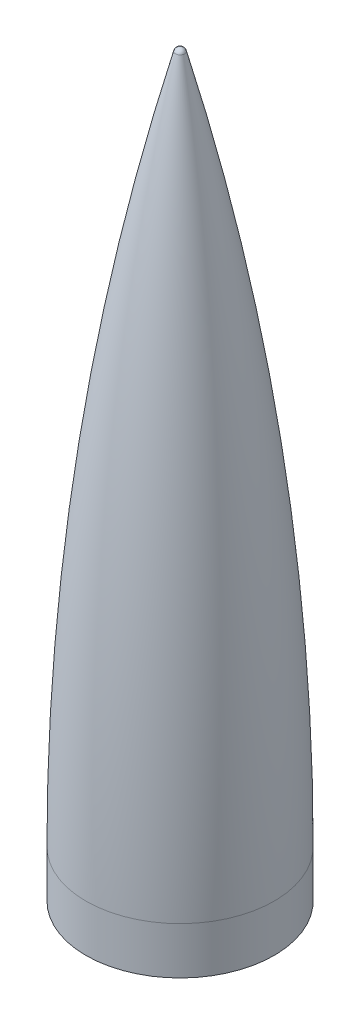
from build123d import *


with BuildPart() as part:
    # Sketch2 → Revolve1 (revolve)
    with BuildSketch(Plane.XY):
        with BuildLine():
            Line((40, 0), (40, -20))
            Line((40, -20), (38, -20))
            Line((38, -20), (38, 0))
            ThreePointArc((38, 0), (28.460188979, 147.36688909), (0, 292.273844194))
            Line((0, 292.273844194), (0, 294.273844194))
            ThreePointArc((0, 294.273844194), (1.220075694, 293.858588748), (1.933508311, 292.785259495))
            ThreePointArc((1.933508311, 292.785259495), (30.443496396, 147.624748913), (40, 0))
        make_face()
    revolve(axis=Axis((0, 294.273844194, 0), (0, -1, 0)))


solid = part.part
